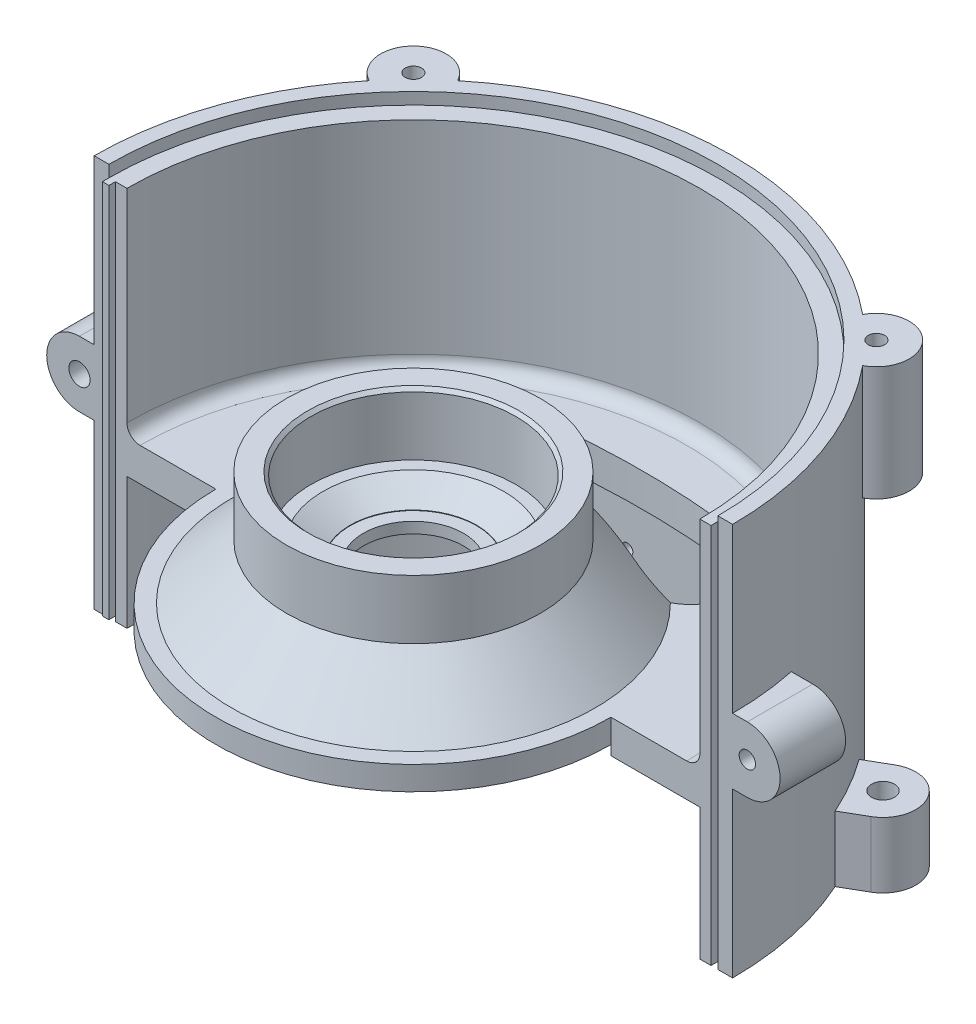
from build123d import *
from build123d.topology import SkipClean

# Parameters (mm, degrees)
REVOLU_O2_ANGLE          = 180
ESBO_O4_R                = 10
RESSALTO_EXTRUS_O1_DEPTH = 35
RESSALTO_EXTRUS_O2_DEPTH = 20
ESBO_O8_R                = 3.5
CORTE_EXTRUS_O2_DEPTH    = 20
PADR_OCIRCULAR1_COUNT    = 6
ESBO_O6_R                = 2.5
CORTE_EXTRUS_O1_DEPTH    = 15
ESBO_O9_R                = 1.25
CORTE_EXTRUS_O3_DEPTH    = 6
ESBO_O10_W               = 2.2
ESBO_O10_H               = 116.4
CORTE_EXTRUS_O4_DEPTH    = 3.5
ESBO_O11_W               = 2
ESBO_O11_H               = 114.9
RESSALTO_EXTRUS_O5_DEPTH = 2
ESBO_O12_R               = 3.25
RESSALTO_EXTRUS_O6_DEPTH = 20
ESBO_O13_R               = 2.5
RESSALTO_EXTRUS_O7_DEPTH = 20
CORTE_EXTRUS_O5_DEPTH    = 180.26806743
CORTE_EXTRUS_O6_START    = 10
ESBO_O16_R               = 93
CORTE_EXTRUS_O6_DEPTH    = 10
ESBO_O17_R               = 92.967356783
ESBO_O17_R_2             = 90.967356783
CORTE_EXTRUS_O7_DEPTH    = 1.5
ESBO_O18_W               = 100
ESBO_O18_H               = 17.238697901
CORTE_EXTRUS_O8_DEPTH    = 15
RESSALTO_EXTRUS_O9_DEPTH = 15
ESBO_O22_R               = 1.65
CORTE_EXTRUS_O9_DEPTH    = 10


with BuildPart() as part:
    # Esboço3 → Revolução2 (revolve)
    with BuildSketch(Plane.XY):
        with BuildLine():
            Line((97.5, 79.8), (97.5, 11.304491341))
            Line((97.5, 11.304491341), (97.5, 0))
            Line((97.5, 0), (97.5, -40.2))
            Line((97.5, -40.2), (87.5, -40.2))
            Line((87.5, -40.2), (87.5, 0))
            Line((87.5, 0), (60.342408243, 0))
            Line((60.342408243, 0), (60.342408243, 2.95))
            Line((60.342408243, 2.95), (52, 2.95))
            Line((52, 2.95), (44, 10.95))
            Line((44, 10.95), (31, 10.95))
            Line((31, 10.95), (31, 13.7))
            Line((31, 13.7), (22.6, 13.7))
            Line((22.6, 13.7), (22.6, 17))
            Line((22.6, 17), (19.3, 17))
            Line((19.3, 17), (19.3, 17.7))
            Line((19.3, 17.7), (15.3, 17.7))
            Line((15.3, 17.7), (15.3, 21.05))
            Line((15.3, 21.05), (19.3, 21.05))
            Line((19.3, 21.05), (19.3, 21.2))
            Line((19.3, 21.2), (27.626549127, 25.96))
            Line((27.626549127, 25.96), (31.3, 25.96))
            Line((31.3, 25.96), (31.3, 43.96))
            Line((31.3, 43.96), (32.3, 44.96))
            Line((32.3, 44.96), (38.8, 44.96))
            Line((38.8, 44.96), (38.8, 26.9))
            Line((38.8, 26.9), (55.5, 10.2))
            Line((55.5, 10.2), (83.5, 10.2))
            ThreePointArc((83.5, 10.2), (86.328427125, 11.371572875), (87.5, 14.2))
            Line((87.5, 14.2), (87.5, 76.2))
            Line((87.5, 76.2), (93, 76.2))
            Line((93, 76.2), (93, 79.8))
            Line((93, 79.8), (97.5, 79.8))
        make_face()
    revolve(axis=Axis((0, -3.322055656, 0), (0, 1, 0)), revolution_arc=REVOLU_O2_ANGLE)

    # Esboço20 → Revolução3 (revolve)
    with SkipClean():  # the faces are left unmerged after this step: merging them gives an invalid solid
        with BuildSketch(Plane.XY, mode=Mode.PRIVATE) as revolu_o3_sk:
            Polygon((60.342408243, 2.95), (60.342408243, 10.2), (55.5, 10.2), (38.8, 26.9), (38.8, 44.96), (32.3, 44.96), (31.3, 43.96), (31.3, 25.96), (27.626549127, 25.96), (19.3, 21.2), (19.3, 21.05), (15.3, 21.05), (15.3, 17.7), (19.3, 17.7), (19.3, 17), (22.6, 17), (22.6, 13.7), (31, 13.7), (31, 10.95), (44, 10.95), (52, 2.95), align=None)
        revolve(revolu_o3_sk.sketch.rotate(Axis((0, -3.322055656, 0), (0, 1, 0)), 90), axis=Axis((0, -3.322055656, 0), (0, 1, 0)))
    add(part.part.scale(1), mode=Mode.REPLACE)  # the faces are merged on a copy

    # Esboço4 → Ressalto-extrusão1 (add)
    with SkipClean():  # the faces are left unmerged after this step: merging them gives an invalid solid
        with BuildSketch(Plane(origin=(0, 79.8, 0), x_dir=(1, 0, 0), z_dir=(0, 1, 0))):
            with Locations((70.71, 70.71)):
                Circle(ESBO_O4_R)
            with Locations((-70.71, 70.71)):
                Circle(ESBO_O4_R)
        extrude(amount=-RESSALTO_EXTRUS_O1_DEPTH)

    # Esboço5 → Ressalto-extrusão2 (add)
    with SkipClean():  # the faces are left unmerged after this step: merging them gives an invalid solid
        with BuildSketch(Plane.XZ.offset(40.2)):
            with BuildLine():
                Line((10, -105), (10, -96.985823706))
                Line((10, -96.985823706), (-10, -96.985823706))
                Line((-10, -96.985823706), (-10, -105))
                ThreePointArc((-10, -105), (0, -115), (10, -105))
            make_face()
        ressalto_extrus_o2 = extrude(amount=-RESSALTO_EXTRUS_O2_DEPTH)

    # Esboço8 → Corte-extrusão2 (cut)
    with SkipClean():  # the faces are left unmerged after this step: merging them gives an invalid solid
        with BuildSketch(Plane.XZ.offset(40.2)):
            with Locations(Location((0, -105, 0), (0, 0, 270))):
                Circle(ESBO_O8_R)
        corte_extrus_o2 = extrude(amount=-CORTE_EXTRUS_O2_DEPTH, mode=Mode.SUBTRACT)

    # PadrãoCircular1: Ressalto-extrusão2, Corte-extrusão2 ×6 about axis, 3 skipped
    with SkipClean():  # the faces are left unmerged after this step: merging them gives an invalid solid
        padr_ocircular1_axis = Axis((0, 0, 0), (0, 1, 0))
        add([ressalto_extrus_o2.rotate(padr_ocircular1_axis, i * 360 / PADR_OCIRCULAR1_COUNT) for i in range(1, PADR_OCIRCULAR1_COUNT) if i not in (2, 3, 4)])
        add([corte_extrus_o2.rotate(padr_ocircular1_axis, i * 360 / PADR_OCIRCULAR1_COUNT) for i in range(1, PADR_OCIRCULAR1_COUNT) if i not in (2, 3, 4)], mode=Mode.SUBTRACT)

    # Esboço6 → Corte-extrusão1 (cut)
    with SkipClean():  # the faces are left unmerged after this step: merging them gives an invalid solid
        with BuildSketch(Plane(origin=(0, 79.8, 0), x_dir=(1, 0, 0), z_dir=(0, 1, 0))):
            with Locations(Location((70.71, 70.71, 0), (0, 0, 270))):
                Circle(ESBO_O6_R)
            with Locations(Location((-70.71, 70.71, 0), (0, 0, 270))):
                Circle(ESBO_O6_R)
        extrude(amount=-CORTE_EXTRUS_O1_DEPTH, mode=Mode.SUBTRACT)

    # Esboço9 → Corte-extrusão3 (cut)
    with SkipClean():  # the faces are left unmerged after this step: merging them gives an invalid solid
        with BuildSketch(Plane.XZ.offset(-13.7)):
            with Locations(Location((18.738329701, -18.738329701, 0), (0, 0, 270))):
                Circle(ESBO_O9_R)
            with Locations(Location((-18.738329701, -18.738329701, 0), (0, 0, 270))):
                Circle(ESBO_O9_R)
            with Locations(Location((-18.738329701, 18.738329701, 0), (0, 0, 270))):
                Circle(ESBO_O9_R)
            with Locations(Location((18.738329701, 18.738329701, 0), (0, 0, 270))):
                Circle(ESBO_O9_R)
        extrude(amount=-CORTE_EXTRUS_O3_DEPTH, mode=Mode.SUBTRACT)

    # Esboço10 → Corte-extrusão4 (cut)
    with SkipClean():  # the faces are left unmerged after this step: merging them gives an invalid solid
        with BuildSketch(Plane.XY):
            with Locations((92, 18)):
                Rectangle(ESBO_O10_W, ESBO_O10_H)
        extrude(amount=-CORTE_EXTRUS_O4_DEPTH, mode=Mode.SUBTRACT)

    # Esboço11 → Ressalto-extrusão5 (add)
    with SkipClean():  # the faces are left unmerged after this step: merging them gives an invalid solid
        with BuildSketch(Plane.XY):
            with Locations((-92, 18.75)):
                Rectangle(ESBO_O11_W, ESBO_O11_H)
        extrude(amount=RESSALTO_EXTRUS_O5_DEPTH)

    # Esboço12 → Ressalto-extrusão6 (add)
    with BuildSketch(Plane.XY):
        with BuildLine():
            Line((-102, 29.8), (-87.5, 29.8))
            Line((-87.5, 29.8), (-87.5, 9.8))
            Line((-87.5, 9.8), (-102, 9.8))
            ThreePointArc((-102, 9.8), (-112, 19.8), (-102, 29.8))
        make_face()
        with Locations((-102, 19.8)):
            Circle(ESBO_O12_R, mode=Mode.SUBTRACT)
    extrude(amount=-RESSALTO_EXTRUS_O6_DEPTH)

    # Esboço13 → Ressalto-extrusão7 (add)
    with BuildSketch(Plane.XY):
        with BuildLine():
            Line((102, 29.8), (93.1, 29.8))
            Line((93.1, 29.8), (93.1, 9.8))
            Line((93.1, 9.8), (102, 9.8))
            ThreePointArc((102, 9.8), (112, 19.8), (102, 29.8))
        make_face()
        with Locations((102, 19.8)):
            Circle(ESBO_O13_R, mode=Mode.SUBTRACT)
    extrude(amount=-RESSALTO_EXTRUS_O7_DEPTH)

    # Esboço14 → Corte-extrusão5 (cut, through all)
    with SkipClean():  # the faces are left unmerged after this step: merging them gives an invalid solid
        with BuildSketch(Plane(origin=(0, 0, 0), x_dir=(-1, 0, 0), z_dir=(0, -1, 0))):
            with BuildLine():
                ThreePointArc((34.350508428, 67.496062714), (0, 70), (-34.350508428, 67.496062714))
                ThreePointArc((-34.350508428, 67.496062714), (-47.016691783, 50.479370931), (-30, 37.813187576))
                ThreePointArc((-30, 37.813187576), (0, 40), (30, 37.813187576))
                ThreePointArc((30, 37.813187576), (47.016691783, 50.479370931), (34.350508428, 67.496062714))
            make_face()
        extrude(amount=-CORTE_EXTRUS_O5_DEPTH, mode=Mode.SUBTRACT)

    # Esboço16 → Corte-extrusão6 (cut)
    with SkipClean():  # the faces are left unmerged after this step: merging them gives an invalid solid
        with BuildSketch(Plane(origin=(0, 76.2, 0), x_dir=(1, 0, 0), z_dir=(0, 1, 0)).offset(CORTE_EXTRUS_O6_START)):
            Circle(ESBO_O16_R)
        extrude(amount=-CORTE_EXTRUS_O6_DEPTH, mode=Mode.SUBTRACT)

    # Esboço17 → Corte-extrusão7 (cut)
    with SkipClean():  # the faces are left unmerged after this step: merging them gives an invalid solid
        with BuildSketch(Plane.XZ.offset(40.2)):
            Circle(ESBO_O17_R)
            Circle(ESBO_O17_R_2, mode=Mode.SUBTRACT)
        extrude(amount=-CORTE_EXTRUS_O7_DEPTH, mode=Mode.SUBTRACT)

    # Esboço18 → Corte-extrusão8 (cut, symmetric)
    with SkipClean():  # the faces are left unmerged after this step: merging them gives an invalid solid
        with BuildSketch(Plane(origin=(0, -20.1, 0), x_dir=(-1, 0, 0), z_dir=(0, -1, 0))):
            with Locations((0, 72.662310295)):
                Rectangle(ESBO_O18_W, ESBO_O18_H)
        extrude(amount=CORTE_EXTRUS_O8_DEPTH, both=True, mode=Mode.SUBTRACT)

    # Esboço19 → Ressalto-extrusão9 (add, symmetric)
    with SkipClean():  # the faces are left unmerged after this step: merging them gives an invalid solid
        with BuildSketch(Plane(origin=(0, -20.1, 0), x_dir=(-1, 0, 0), z_dir=(0, -1, 0))):
            with BuildLine():
                Line((32.396633626, 81.281659245), (-32.396633626, 81.281659245))
                ThreePointArc((-32.396633626, 81.281659245), (0, 87.5), (32.396633626, 81.281659245))
            make_face()
        extrude(amount=RESSALTO_EXTRUS_O9_DEPTH, both=True)

    # Esboço22 → Corte-extrusão9 (cut)
    with SkipClean():  # the faces are left unmerged after this step: merging them gives an invalid solid
        with BuildSketch(Plane.XY.offset(-81.281659245)):
            with Locations((-15.9, -24.1)):
                Circle(ESBO_O22_R)
            with Locations((15.9, -24.1)):
                Circle(ESBO_O22_R)
        extrude(amount=-CORTE_EXTRUS_O9_DEPTH, mode=Mode.SUBTRACT)


solid = part.part
